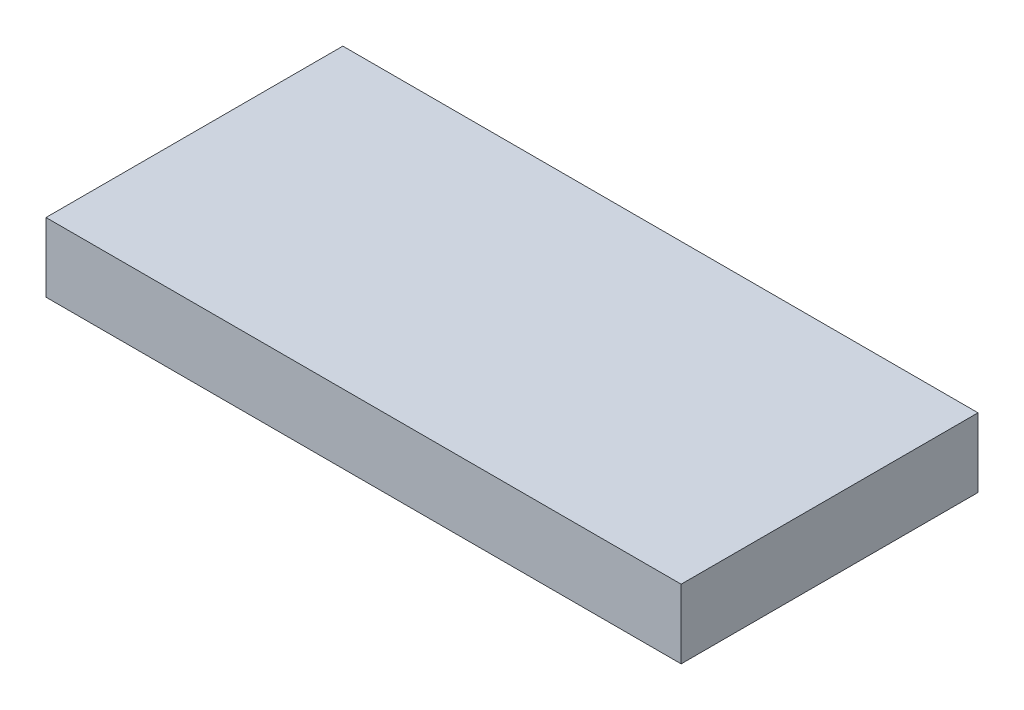
from build123d import *

# Parameters (mm, degrees)
SKETCH1_W           = 184
SKETCH1_H           = 86
BOSS_EXTRUDE1_DEPTH = 20


with BuildPart() as part:
    # Sketch1 → Boss-Extrude1 (new body)
    with BuildSketch(Plane(origin=(0, 0, 0), x_dir=(1, 0, 0), z_dir=(0, 1, 0))):
        Rectangle(SKETCH1_W, SKETCH1_H)
    extrude(amount=BOSS_EXTRUDE1_DEPTH)


solid = part.part
